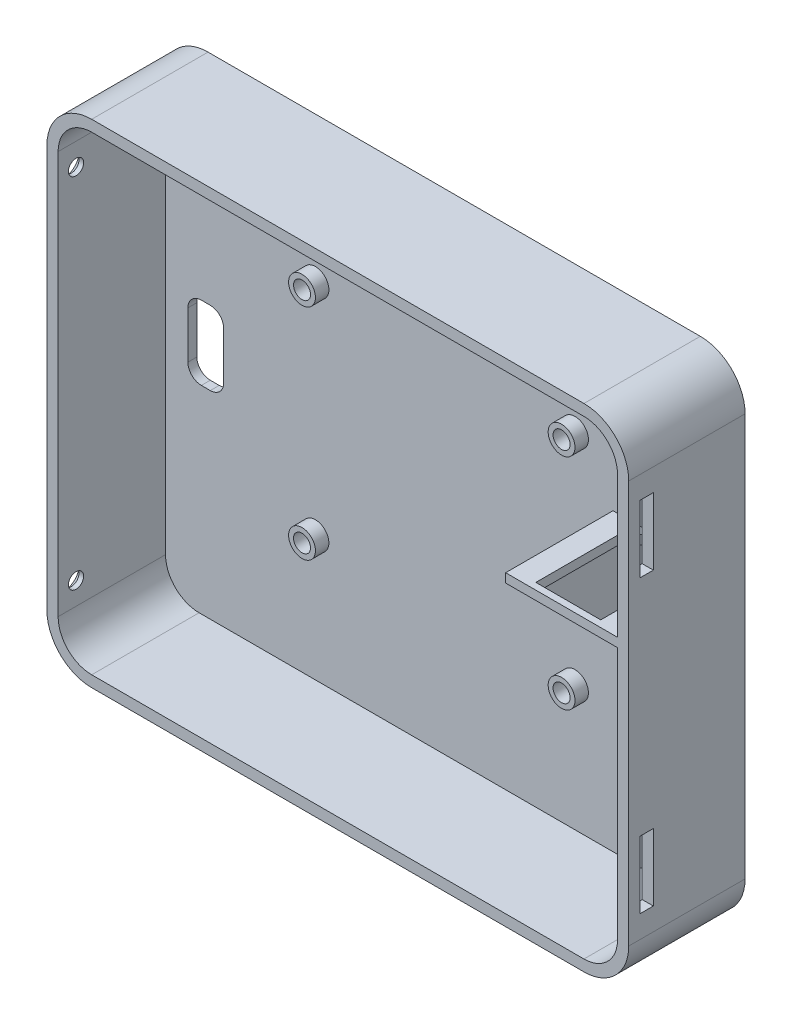
from build123d import *

# Parameters (mm, degrees)
P_IDAT_VYSUNUT_M1_DEPTH                           = 2
P_IDAT_VYSUNUT_M2_DEPTH                           = 24
SKICA6_R                                          = 3
P_IDAT_VYSUNUT_M3_DEPTH                           = 3
D_RY_PRO_KOL_K_VELIKOST_MM1_D                     = 3.8
D_RY_PRO_KOL_K_VELIKOST_MM1_DEPTH                 = 3.8
ODEBRAT_VYSUNUT_M1_DEPTH                          = 3
SKICA12_W                                         = 24
SKICA12_H                                         = 2
P_IDAT_VYSUNUT_M4_DEPTH                           = 25
P_IDAT_VYSUNUT_M5_DEPTH                           = 2
SKICA14_W                                         = 7.25
SKICA14_H                                         = 10.5
ODEBRAT_VYSUNUT_M2_DEPTH                          = 9.212713479
V_LCOV_ZAHLOUBEN_PRO_M3_ROUBY_S_PLOCH_D           = 3.4
V_LCOV_ZAHLOUBEN_PRO_M3_ROUBY_S_PLOCH_DEPTH       = 3.8
V_LCOV_ZAHLOUBEN_PRO_M3_ROUBY_S_PLOCH_CSINK_D     = 6.3
V_LCOV_ZAHLOUBEN_PRO_M3_ROUBY_S_PLOCH_CSINK_ANGLE = 90
V_LCOV_ZAHLOUBEN_PRO_M3_ROUBY_S_PLOCH_TIP         = 1.021463052
SKICA17_W                                         = 3
SKICA17_H                                         = 15
ODEBRAT_VYSUNUT_M3_DEPTH                          = 9.212713479
DUTINA1_OUTLINE_R                                 = 7.5
DUTINA1_DEPTH                                     = 1.2


# Read off the part's stored shape, not the designer's step: Dutina1
with BuildPart() as part:
    # Skica1 → Přidat vysunutím1 (new body)
    with BuildSketch(Plane.XY):
        with BuildLine():
            Line((-55, 55), (55, 55))
            ThreePointArc((55, 55), (62.071067812, 52.071067812), (65, 45))
            Line((65, 45), (65, -45))
            ThreePointArc((65, -45), (62.071067812, -52.071067812), (55, -55))
            Line((55, -55), (-55, -55))
            ThreePointArc((-55, -55), (-62.071067812, -52.071067812), (-65, -45))
            Line((-65, -45), (-65, 45))
            ThreePointArc((-65, 45), (-62.071067812, 52.071067812), (-55, 55))
        make_face()
    extrude(amount=P_IDAT_VYSUNUT_M1_DEPTH)

    # Skica2 → Přidat vysunutím2 (add)
    with BuildSketch(Plane.XY.offset(2)):
        with BuildLine():
            Line((55, 55), (-55, 55))
            ThreePointArc((-55, 55), (-62.071067812, 52.071067812), (-65, 45))
            Line((-65, 45), (-65, -45))
            ThreePointArc((-65, -45), (-62.071067812, -52.071067812), (-55, -55))
            Line((-55, -55), (55, -55))
            ThreePointArc((55, -55), (62.071067812, -52.071067812), (65, -45))
            Line((65, -45), (65, 45))
            ThreePointArc((65, 45), (62.071067812, 52.071067812), (55, 55))
        make_face()
        with BuildLine():
            Line((-55, -52.5), (55, -52.5))
            ThreePointArc((55, -52.5), (60.303300859, -50.303300859), (62.5, -45))
            Line((62.5, -45), (62.5, 45))
            ThreePointArc((62.5, 45), (60.303300859, 50.303300859), (55, 52.5))
            Line((55, 52.5), (-55, 52.5))
            ThreePointArc((-55, 52.5), (-60.303300859, 50.303300859), (-62.5, 45))
            Line((-62.5, 45), (-62.5, -45))
            ThreePointArc((-62.5, -45), (-60.303300859, -50.303300859), (-55, -52.5))
        make_face(mode=Mode.SUBTRACT)
    extrude(amount=P_IDAT_VYSUNUT_M2_DEPTH)

    # Skica6 → Přidat vysunutím3 (add)
    with BuildSketch(Plane.XY.offset(2)):
        with BuildLine():
            ThreePointArc((29, -21.5), (26.878679656, -22.378679656), (26, -24.5))
            Line((26, -24.5), (29, -24.5))
            Line((29, -24.5), (29, -21.5))
        make_face()
        with BuildLine():
            Line((29, -24.5), (26, -24.5))
            ThreePointArc((26, -24.5), (29, -27.5), (32, -24.5))
            ThreePointArc((32, -24.5), (31.121320344, -22.378679656), (29, -21.5))
            Line((29, -21.5), (29, -24.5))
        make_face()
        with BuildLine():
            ThreePointArc((26, 24.5), (26.878679656, 22.378679656), (29, 21.5))
            Line((29, 21.5), (29, 24.5))
            Line((29, 24.5), (26, 24.5))
        make_face()
        with BuildLine():
            Line((29, 24.5), (29, 21.5))
            ThreePointArc((29, 21.5), (31.121320344, 22.378679656), (32, 24.5))
            ThreePointArc((32, 24.5), (29, 27.5), (26, 24.5))
            Line((26, 24.5), (29, 24.5))
        make_face()
        with Locations((-29, 24.5)):
            Circle(SKICA6_R)
        with Locations((-29, -24.5)):
            Circle(SKICA6_R)
    extrude(amount=P_IDAT_VYSUNUT_M3_DEPTH)

    # Díry pro kolík, velikost mm1
    with Locations(Plane.XY.offset(5)):
        with Locations((29, 24.5), (29, -24.5), (-29, -24.5), (-29, 24.5)):
            Hole(D_RY_PRO_KOL_K_VELIKOST_MM1_D / 2, depth=D_RY_PRO_KOL_K_VELIKOST_MM1_DEPTH)

    # Skica11 → Odebrat vysunutím1 (cut)
    with BuildSketch(Plane.XY.offset(2)):
        with BuildLine():
            Line((-49.5, 0), (-57.5, 0))
            Line((-57.5, 0), (-57.5, -5.25))
            ThreePointArc((-57.5, -5.25), (-56.621320344, -7.371320344), (-54.5, -8.25))
            Line((-54.5, -8.25), (-52.5, -8.25))
            ThreePointArc((-52.5, -8.25), (-50.378679656, -7.371320344), (-49.5, -5.25))
            Line((-49.5, -5.25), (-49.5, 0))
        make_face()
        with BuildLine():
            Line((-57.5, 5.25), (-57.5, 0))
            Line((-57.5, 0), (-49.5, 0))
            Line((-49.5, 0), (-49.5, 5.25))
            ThreePointArc((-49.5, 5.25), (-50.378679656, 7.371320344), (-52.5, 8.25))
            Line((-52.5, 8.25), (-54.5, 8.25))
            ThreePointArc((-54.5, 8.25), (-56.621320344, 7.371320344), (-57.5, 5.25))
        make_face()
    extrude(amount=-ODEBRAT_VYSUNUT_M1_DEPTH, mode=Mode.SUBTRACT)

    # Skica12 → Přidat vysunutím4 (add)
    with BuildSketch(Plane.ZY.offset(-62.5)):
        with Locations((14, 12.5)):
            Rectangle(SKICA12_W, SKICA12_H)
    extrude(amount=P_IDAT_VYSUNUT_M4_DEPTH)

    # Skica13 → Přidat vysunutím5 (add)
    with BuildSketch(Plane.ZY.offset(-37.5)):
        Polygon((2, -12.5), (2, 11.5), (26, 11.5), align=None)
    extrude(amount=-P_IDAT_VYSUNUT_M5_DEPTH)

    # Skica14 → Odebrat vysunutím2 (cut)
    with BuildSketch(Plane(origin=(0, 13.5, 0), x_dir=(1, 0, 0), z_dir=(0, 1, 0))):
        with Locations((46.375, -8.75)):
            Rectangle(SKICA14_W, SKICA14_H)
        with Locations((53.625, -8.75)):
            Rectangle(SKICA14_W, SKICA14_H)
        with Locations((53.625, -19.25)):
            Rectangle(SKICA14_W, SKICA14_H)
        with Locations((46.375, -19.25)):
            Rectangle(SKICA14_W, SKICA14_H)
    extrude(amount=-ODEBRAT_VYSUNUT_M2_DEPTH, mode=Mode.SUBTRACT)

    # Válcové zahloubení pro M3 šrouby s plochou hlavou1
    with Locations(Plane(origin=(-65, 40, 22), x_dir=(0, 0, -1), z_dir=(-1, 0, 0))):
        with Locations((0, 0), (0, 80)):
            CounterSinkHole(V_LCOV_ZAHLOUBEN_PRO_M3_ROUBY_S_PLOCH_D / 2, V_LCOV_ZAHLOUBEN_PRO_M3_ROUBY_S_PLOCH_CSINK_D / 2, depth=V_LCOV_ZAHLOUBEN_PRO_M3_ROUBY_S_PLOCH_DEPTH, counter_sink_angle=V_LCOV_ZAHLOUBEN_PRO_M3_ROUBY_S_PLOCH_CSINK_ANGLE)
            with Locations((0, 0, -(V_LCOV_ZAHLOUBEN_PRO_M3_ROUBY_S_PLOCH_DEPTH + V_LCOV_ZAHLOUBEN_PRO_M3_ROUBY_S_PLOCH_TIP / 2))):  # 118° drill point
                Cone(0, V_LCOV_ZAHLOUBEN_PRO_M3_ROUBY_S_PLOCH_D / 2, V_LCOV_ZAHLOUBEN_PRO_M3_ROUBY_S_PLOCH_TIP, mode=Mode.SUBTRACT)

    # Skica17 → Odebrat vysunutím3 (cut)
    with BuildSketch(Plane(origin=(65, 0, 0), x_dir=(0, 0, -1), z_dir=(1, 0, 0))):
        with Locations((-22, 32.5)):
            Rectangle(SKICA17_W, SKICA17_H)
        with Locations((-22, -32.5)):
            Rectangle(SKICA17_W, SKICA17_H)
    extrude(amount=-ODEBRAT_VYSUNUT_M3_DEPTH, mode=Mode.SUBTRACT)

    # Dutina1 outline → Dutina1 (cut)
    with BuildSketch(Plane.XY):
        Circle(DUTINA1_OUTLINE_R)
        with BuildLine():
            Line((10.253048327, 10.253048327), (15.202795796, 15.202795796))
            ThreePointArc((15.202795796, 15.202795796), (0, 21.5), (-15.202795796, 15.202795796))
            Line((-15.202795796, 15.202795796), (-10.253048327, 10.253048327))
            ThreePointArc((-10.253048327, 10.253048327), (0, 14.5), (10.253048327, 10.253048327))
        make_face()
        with BuildLine():
            Line((20.152543264, 20.152543264), (25.102290732, 25.102290732))
            ThreePointArc((25.102290732, 25.102290732), (0, 35.5), (-25.102290732, 25.102290732))
            Line((-25.102290732, 25.102290732), (-20.152543264, 20.152543264))
            ThreePointArc((-20.152543264, 20.152543264), (0, 28.5), (20.152543264, 20.152543264))
        make_face()
        with BuildLine():
            ThreePointArc((-15.202795796, -15.202795796), (0, -21.5), (15.202795796, -15.202795796))
            Line((15.202795796, -15.202795796), (10.253048327, -10.253048327))
            ThreePointArc((10.253048327, -10.253048327), (0, -14.5), (-10.253048327, -10.253048327))
            Line((-10.253048327, -10.253048327), (-15.202795796, -15.202795796))
        make_face()
        with BuildLine():
            Line((-20.152543264, -20.152543264), (-25.102290732, -25.102290732))
            ThreePointArc((-25.102290732, -25.102290732), (0, -35.5), (25.102290732, -25.102290732))
            Line((25.102290732, -25.102290732), (20.152543264, -20.152543264))
            ThreePointArc((20.152543264, -20.152543264), (0, -28.5), (-20.152543264, -20.152543264))
        make_face()
    extrude(amount=DUTINA1_DEPTH, mode=Mode.SUBTRACT)


solid = part.part
